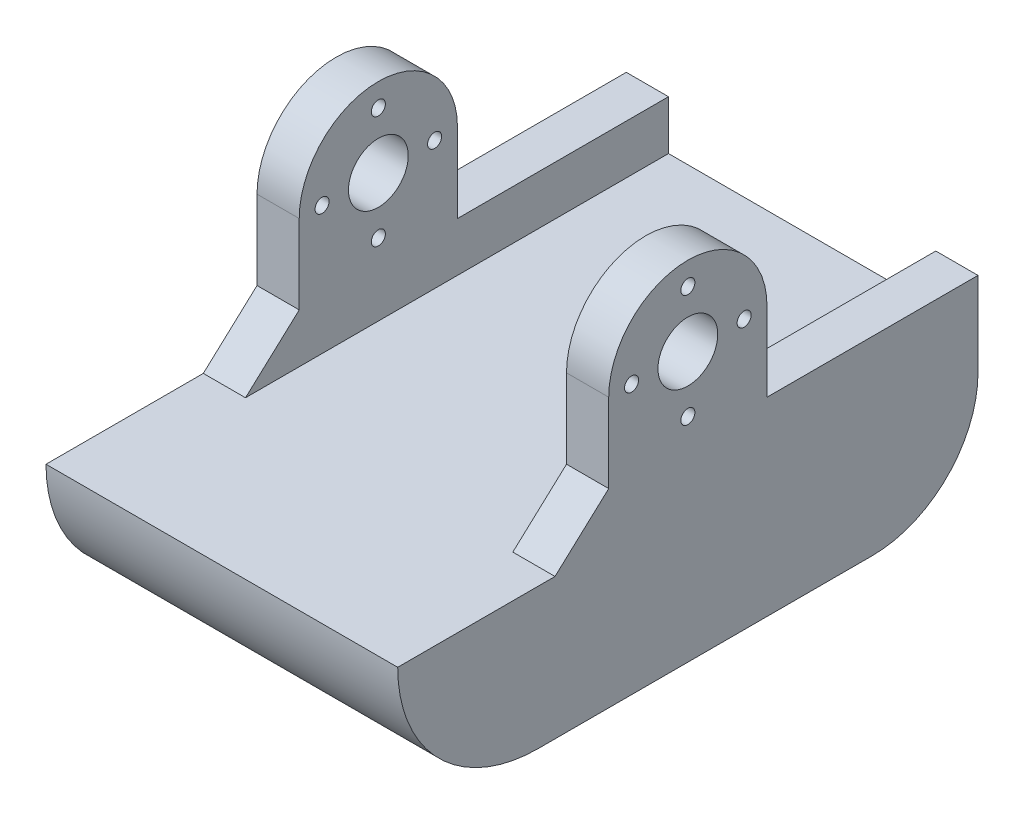
from build123d import *

# Parameters (mm, degrees)
SKETCH1_W            = 50
SKETCH1_H            = 170
BOSS_EXTRUDE1_DEPTH  = 55
SKETCH2_W            = 34
SKETCH2_H            = 27
CUT_EXTRUDE1_DEPTH   = 181.416185527
SKETCH3_W            = 10
SKETCH3_H            = 24
SKETCH3_R            = 4.25
SKETCH3_R_2          = 1
CUT_EXTRUDE2_DEPTH   = 186.539753153
SKETCH4_W            = 2
SKETCH4_H            = 24
CUT_EXTRUDE3_DEPTH   = 178.623196683
SKETCH5_W            = 6.25
SKETCH5_H            = 11.25
CUT_EXTRUDE4_DEPTH   = 186.539753153
SKETCH6_W            = 38
SKETCH6_H            = 10
CUT_EXTRUDE5_DEPTH   = 181.416185527
SKETCH8_W            = 13.25
SKETCH8_H            = 2.25
CUT_EXTRUDE7_DEPTH   = 186.539753153
SKETCH9_W            = 34
SKETCH9_H            = 35.25
CUT_EXTRUDE8_DEPTH   = 179.297679458
SKETCH11_W           = 13.25
SKETCH11_H           = 20.25
CUT_EXTRUDE9_DEPTH   = 184.480414486
SKETCH12_W           = 28.5
SKETCH12_H           = 15
BOSS_EXTRUDE2_DEPTH  = 8
SKETCH14_W           = 34
SKETCH14_H           = 15
SKETCH14_H_2         = 10.25
BOSS_EXTRUDE3_DEPTH  = 13.25
SKETCH16_R           = 4.5
SKETCH16_R_2         = 2.5
CUT_EXTRUDE13_DEPTH  = 8
SKETCH17_R           = 4.5
SKETCH17_W           = 55
SKETCH17_H           = 10.25
CUT_EXTRUDE15_DEPTH  = 175.384811552
SKETCH18_W           = 71.25
SKETCH18_H           = 27.5
SKETCH18_W_2         = 13.75
SKETCH18_W_3         = 16.25
BOSS_EXTRUDE4_DEPTH  = 50
SKETCH19_W           = 38
SKETCH19_H           = 7
CUT_EXTRUDE16_DEPTH  = 152.25227271
SKETCH20_W           = 57.5
SKETCH20_H           = 27.5
CUT_EXTRUDE17_DEPTH  = 102.137591923
CUT_EXTRUDE18_DEPTH  = 100.39221549
SKETCH22_W           = 82.5
SKETCH22_H           = 2.5
BOSS_EXTRUDE5_DEPTH  = 50
SKETCH24_W           = 22
SKETCH24_H           = 17
CUT_EXTRUDE19_DEPTH  = 101.710289941
SKETCH25_W           = 38
SKETCH25_H           = 38.136363636
CUT_EXTRUDE20_DEPTH  = 10
SKETCH26_W           = 82.5
SKETCH26_H           = 2.5
CUT_EXTRUDE21_DEPTH  = 101.710289941
SKETCH27_W           = 38
SKETCH27_H           = 5
BOSS_EXTRUDE6_DEPTH  = 60.14
SKETCH29_W           = 38
SKETCH29_H           = 5
BOSS_EXTRUDE8_DEPTH  = 60.14
SKETCH30_W           = 6
SKETCH30_H           = 17
BOSS_EXTRUDE9_DEPTH  = 22.14
SKETCH31_W           = 22.363636364
SKETCH31_H           = 20.5
BOSS_EXTRUDE10_DEPTH = 50
SKETCH32_W           = 82.5
SKETCH32_H           = 0.5
SKETCH32_W_2         = 0.14
SKETCH32_H_2         = 17
CUT_EXTRUDE22_DEPTH  = 100.489105434
FILLET1_R            = 15
FILLET2_R            = 20


with BuildPart() as part:
    # Sketch1 → Boss-Extrude1 (new body)
    with BuildSketch(Plane.XY):
        with Locations((0, -85)):
            Rectangle(SKETCH1_W, SKETCH1_H)
    extrude(amount=-BOSS_EXTRUDE1_DEPTH)

    # Sketch2 → Cut-Extrude1 (cut, through all)
    with BuildSketch(Plane.XY):
        with Locations((0, -13.5)):
            Rectangle(SKETCH2_W, SKETCH2_H)
    extrude(amount=-CUT_EXTRUDE1_DEPTH, mode=Mode.SUBTRACT)

    # Sketch3 → Cut-Extrude2 (cut, through all)
    with BuildSketch(Plane(origin=(25, 0, 0), x_dir=(0, 0, -1), z_dir=(1, 0, 0))):
        with Locations((50, -12)):
            Rectangle(SKETCH3_W, SKETCH3_H)
        with Locations((5, -12)):
            Rectangle(SKETCH3_W, SKETCH3_H)
        with Locations(Location((27.5, -12.75, 0), (0, 0, 90))):
            Circle(SKETCH3_R)
        with Locations(Location((35.5, -12.75, 0), (0, 0, 90))):
            Circle(SKETCH3_R_2)
        with Locations(Location((27.5, -4.75, 0), (0, 0, 90))):
            Circle(SKETCH3_R_2)
        with Locations(Location((27.5, -20.75, 0), (0, 0, 90))):
            Circle(SKETCH3_R_2)
        with Locations(Location((19.5, -12.75, 0), (0, 0, 90))):
            Circle(SKETCH3_R_2)
    extrude(amount=-CUT_EXTRUDE2_DEPTH, mode=Mode.SUBTRACT)

    # Sketch4 → Cut-Extrude3 (cut, through all)
    with BuildSketch(Plane.XY.offset(-10)):
        with Locations((-18, -12)):
            Rectangle(SKETCH4_W, SKETCH4_H)
        with Locations((18, -12)):
            Rectangle(SKETCH4_W, SKETCH4_H)
    extrude(amount=-CUT_EXTRUDE3_DEPTH, mode=Mode.SUBTRACT)

    # Sketch5 → Cut-Extrude4 (cut, through all)
    with BuildSketch(Plane(origin=(25, 0, 0), x_dir=(0, 0, -1), z_dir=(1, 0, 0))):
        with BuildLine():
            Line((45, 0), (10, 0))
            Line((10, 0), (10, -12.75))
            Line((10, -12.75), (16.25, -12.75))
            ThreePointArc((16.25, -12.75), (27.5, -1.5), (38.75, -12.75))
            Line((38.75, -12.75), (45, -12.75))
            Line((45, -12.75), (45, 0))
        make_face()
        with Locations((13.125, -18.375)):
            Rectangle(SKETCH5_W, SKETCH5_H)
        with Locations((41.875, -18.375)):
            Rectangle(SKETCH5_W, SKETCH5_H)
    extrude(amount=-CUT_EXTRUDE4_DEPTH, mode=Mode.SUBTRACT)

    # Sketch6 → Cut-Extrude5 (cut, through all)
    with BuildSketch(Plane.XY):
        with Locations((0, -29)):
            Rectangle(SKETCH6_W, SKETCH6_H)
    extrude(amount=-CUT_EXTRUDE5_DEPTH, mode=Mode.SUBTRACT)

    # Sketch8 → Cut-Extrude7 (cut, through all)
    with BuildSketch(Plane(origin=(25, 0, 0), x_dir=(0, 0, -1), z_dir=(1, 0, 0))):
        with BuildLine():
            Line((27.5, -157.5), (27.5, -132.5))
            Line((27.5, -132.5), (13.25, -132.5))
            Line((13.25, -132.5), (13.25, -167.75))
            Line((13.25, -167.75), (17.25, -167.75))
            ThreePointArc((17.25, -167.75), (20.252155493, -160.502155493), (27.5, -157.5))
        make_face()
        with BuildLine():
            Line((41.75, -167.75), (41.75, -132.5))
            Line((41.75, -132.5), (27.5, -132.5))
            Line((27.5, -132.5), (27.5, -157.5))
            ThreePointArc((27.5, -157.5), (34.747844507, -160.502155493), (37.75, -167.75))
            Line((37.75, -167.75), (41.75, -167.75))
        make_face()
        with Locations((48.375, -168.875)):
            Rectangle(SKETCH8_W, SKETCH8_H)
        with Locations((6.625, -168.875)):
            Rectangle(SKETCH8_W, SKETCH8_H)
        with BuildLine():
            Line((17.25, -167.75), (13.25, -167.75))
            Line((13.25, -167.75), (13.25, -170))
            Line((13.25, -170), (17.5, -170))
            ThreePointArc((17.5, -170), (17.31269172, -168.881923142), (17.25, -167.75))
        make_face()
        with BuildLine():
            Line((41.75, -170), (41.75, -167.75))
            Line((41.75, -167.75), (37.75, -167.75))
            ThreePointArc((37.75, -167.75), (37.68730828, -168.881923142), (37.5, -170))
            Line((37.5, -170), (41.75, -170))
        make_face()
        with BuildLine():
            Line((27.5, -167.75), (27.5, -157.5))
            ThreePointArc((27.5, -157.5), (20.252155493, -160.502155493), (17.25, -167.75))
            Line((17.25, -167.75), (27.5, -167.75))
        make_face()
        with BuildLine():
            ThreePointArc((37.75, -167.75), (34.747844507, -160.502155493), (27.5, -157.5))
            Line((27.5, -157.5), (27.5, -167.75))
            Line((27.5, -167.75), (37.75, -167.75))
        make_face()
        with BuildLine():
            Line((27.5, -170), (27.5, -167.75))
            Line((27.5, -167.75), (17.25, -167.75))
            ThreePointArc((17.25, -167.75), (17.31269172, -168.881923142), (17.5, -170))
            Line((17.5, -170), (27.5, -170))
        make_face()
        with BuildLine():
            ThreePointArc((37.5, -170), (37.68730828, -168.881923142), (37.75, -167.75))
            Line((37.75, -167.75), (27.5, -167.75))
            Line((27.5, -167.75), (27.5, -170))
            Line((27.5, -170), (37.5, -170))
        make_face()
    extrude(amount=-CUT_EXTRUDE7_DEPTH, mode=Mode.SUBTRACT)

    # Sketch9 → Cut-Extrude8 (cut, through all)
    with BuildSketch(Plane.XY):
        with Locations((0, -150.125)):
            Rectangle(SKETCH9_W, SKETCH9_H)
    extrude(amount=-CUT_EXTRUDE8_DEPTH, mode=Mode.SUBTRACT)

    # Sketch11 → Cut-Extrude9 (cut, through all)
    with BuildSketch(Plane(origin=(25, 0, 0), x_dir=(0, 0, -1), z_dir=(1, 0, 0))):
        with BuildLine():
            ThreePointArc((17.25, -167.75), (20.252155493, -160.502155493), (27.5, -157.5))
            Line((27.5, -157.5), (27.5, -147.5))
            Line((27.5, -147.5), (13.25, -147.5))
            Line((13.25, -147.5), (13.25, -167.75))
            Line((13.25, -167.75), (17.25, -167.75))
        make_face()
        with BuildLine():
            Line((27.5, -147.5), (27.5, -157.5))
            ThreePointArc((27.5, -157.5), (34.747844507, -160.502155493), (37.75, -167.75))
            Line((37.75, -167.75), (41.75, -167.75))
            Line((41.75, -167.75), (41.75, -147.5))
            Line((41.75, -147.5), (27.5, -147.5))
        make_face()
        with Locations((48.375, -157.625)):
            Rectangle(SKETCH11_W, SKETCH11_H)
        with Locations((6.625, -157.625)):
            Rectangle(SKETCH11_W, SKETCH11_H)
    extrude(amount=-CUT_EXTRUDE9_DEPTH, mode=Mode.SUBTRACT)

    # Sketch12 → Boss-Extrude2 (add)
    with BuildSketch(Plane(origin=(25, 0, 0), x_dir=(0, 0, -1), z_dir=(1, 0, 0))):
        with Locations((27.5, -140)):
            Rectangle(SKETCH12_W, SKETCH12_H)
    boss_extrude2 = extrude(amount=-BOSS_EXTRUDE2_DEPTH)

    # Mirror1: Boss-Extrude2 across plane
    add(boss_extrude2.mirror(Plane(origin=(0, 0, 0), x_dir=(0, 0, 1), z_dir=(1, 0, 0))))

    # Sketch14 → Boss-Extrude3 (add)
    with BuildSketch(Plane.XY):
        with Locations((0, -140)):
            Rectangle(SKETCH14_W, SKETCH14_H)
        with Locations((0, -152.625)):
            Rectangle(SKETCH14_W, SKETCH14_H_2)
    boss_extrude3 = extrude(amount=-BOSS_EXTRUDE3_DEPTH)

    # Mirror2: Boss-Extrude3 across plane
    add(boss_extrude3.mirror(Plane.XY.offset(-27.5)))

    # Sketch16 → Cut-Extrude13 (cut)
    # profile 1 of 3: a face of its own
    with BuildSketch(Plane(origin=(25, 0, 0), x_dir=(0, 0, -1), z_dir=(1, 0, 0))):
        with Locations(Location((16.5, -135.75, 0), (0, 0, 90))):
            Circle(SKETCH16_R)
        with Locations((16.5, -135.75)):
            Circle(SKETCH16_R_2, mode=Mode.SUBTRACT)
    # profile 2 of 3: a face of its own
    with BuildSketch(Plane(origin=(25, 0, 0), x_dir=(0, 0, -1), z_dir=(1, 0, 0))):
        with Locations((16.5, -135.75)):
            Circle(SKETCH16_R_2)
    # profile 3 of 3: a face of its own
    with BuildSketch(Plane(origin=(25, 0, 0), x_dir=(0, 0, -1), z_dir=(1, 0, 0))):
        with Locations(Location((38.5, -135.75, 0), (0, 0, 90))):
            Circle(SKETCH16_R)
    cut_extrude13 = extrude(amount=-CUT_EXTRUDE13_DEPTH, mode=Mode.SUBTRACT)

    # Mirror3: Cut-Extrude13 across plane
    add(cut_extrude13.mirror(Plane(origin=(0, 0, 0), x_dir=(0, 0, 1), z_dir=(1, 0, 0))), mode=Mode.SUBTRACT)

    # Sketch17 → Cut-Extrude15 (cut, through all)
    # profile 1 of 4: a face of its own
    with BuildSketch(Plane(origin=(25, 0, 0), x_dir=(0, 0, -1), z_dir=(1, 0, 0))):
        Polygon((55, -51.5), (27.5, -51.5), (0, -51.5), (0, -147.5), (55, -147.5), align=None)
        with Locations((16.5, -135.75)):
            Circle(SKETCH17_R, mode=Mode.SUBTRACT)
        with Locations((38.5, -135.75)):
            Circle(SKETCH17_R, mode=Mode.SUBTRACT)
    # profile 2 of 4: a face of its own
    with BuildSketch(Plane(origin=(25, 0, 0), x_dir=(0, 0, -1), z_dir=(1, 0, 0))):
        with Locations((27.5, -152.625)):
            Rectangle(SKETCH17_W, SKETCH17_H)
    # profile 3 of 4: a face of its own
    with BuildSketch(Plane(origin=(25, 0, 0), x_dir=(0, 0, -1), z_dir=(1, 0, 0))):
        with Locations((38.5, -135.75)):
            Circle(SKETCH17_R)
    # profile 4 of 4: a face of its own
    with BuildSketch(Plane(origin=(25, 0, 0), x_dir=(0, 0, -1), z_dir=(1, 0, 0))):
        with Locations((16.5, -135.75)):
            Circle(SKETCH17_R)
    extrude(amount=-CUT_EXTRUDE15_DEPTH, mode=Mode.SUBTRACT)

    # Sketch18 → Boss-Extrude4 (add)
    with BuildSketch(Plane(origin=(25, 0, 0), x_dir=(0, 0, -1), z_dir=(1, 0, 0))):
        with Locations((-35.625, -37.75)):
            Rectangle(SKETCH18_W, SKETCH18_H)
        with Locations((61.875, -37.75)):
            Rectangle(SKETCH18_W_2, SKETCH18_H)
        Polygon((38.75, -51.5), (38.75, -24), (16.25, -24), (0, -24), (0, -51.5), align=None)
        with Locations((46.875, -37.75)):
            Rectangle(SKETCH18_W_3, SKETCH18_H)
    extrude(amount=-BOSS_EXTRUDE4_DEPTH)

    # Sketch19 → Cut-Extrude16 (cut, through all)
    with BuildSketch(Plane.XY.offset(71.25)):
        with Locations((0, -27.5)):
            Rectangle(SKETCH19_W, SKETCH19_H)
    extrude(amount=-CUT_EXTRUDE16_DEPTH, mode=Mode.SUBTRACT)

    # Sketch20 → Cut-Extrude17 (cut, through all)
    with BuildSketch(Plane(origin=(25, 0, 0), x_dir=(0, 0, -1), z_dir=(1, 0, 0))):
        with Locations((-42.5, -37.75)):
            Rectangle(SKETCH20_W, SKETCH20_H)
    extrude(amount=-CUT_EXTRUDE17_DEPTH, mode=Mode.SUBTRACT)

    # Sketch21 → Cut-Extrude18 (cut, through all)
    with BuildSketch(Plane(origin=(25, 0, 0), x_dir=(0, 0, -1), z_dir=(1, 0, 0))):
        Polygon((16.25, -24), (-13.75, -51.5), (-13.75, -24), align=None)
    extrude(amount=-CUT_EXTRUDE18_DEPTH, mode=Mode.SUBTRACT)

    # Sketch22 → Boss-Extrude5 (add)
    with BuildSketch(Plane(origin=(25, 0, 0), x_dir=(0, 0, -1), z_dir=(1, 0, 0))):
        with Locations((27.5, -52.75)):
            Rectangle(SKETCH22_W, SKETCH22_H)
    extrude(amount=-BOSS_EXTRUDE5_DEPTH)

    # Sketch24 → Cut-Extrude19 (cut, through all)
    with BuildSketch(Plane(origin=(25, 0, 0), x_dir=(0, 0, -1), z_dir=(1, 0, 0))):
        with Locations((57.75, -32.5)):
            Rectangle(SKETCH24_W, SKETCH24_H)
    extrude(amount=-CUT_EXTRUDE19_DEPTH, mode=Mode.SUBTRACT)

    # Sketch25 → Cut-Extrude20 (cut)
    with BuildSketch(Plane(origin=(0, -31, 0), x_dir=(1, 0, 0), z_dir=(0, 1, 0))):
        with Locations((0, 27.681818182)):
            Rectangle(SKETCH25_W, SKETCH25_H)
    extrude(amount=-CUT_EXTRUDE20_DEPTH, mode=Mode.SUBTRACT)

    # Sketch26 → Cut-Extrude21 (cut, through all)
    with BuildSketch(Plane(origin=(25, 0, 0), x_dir=(0, 0, -1), z_dir=(1, 0, 0))):
        with Locations((27.5, -52.75)):
            Rectangle(SKETCH26_W, SKETCH26_H)
    extrude(amount=-CUT_EXTRUDE21_DEPTH, mode=Mode.SUBTRACT)

    # Sketch27 → Boss-Extrude6 (add)
    with BuildSketch(Plane(origin=(0, 0, -8.613636364), x_dir=(-1, 0, 0), z_dir=(0, 0, -1))):
        with Locations((0, -38.5)):
            Rectangle(SKETCH27_W, SKETCH27_H)
    extrude(amount=BOSS_EXTRUDE6_DEPTH)

    # Sketch29 → Boss-Extrude8 (add)
    with BuildSketch(Plane(origin=(0, 0, -8.613636364), x_dir=(-1, 0, 0), z_dir=(0, 0, -1))):
        with Locations((0, -33.5)):
            Rectangle(SKETCH29_W, SKETCH29_H)
    extrude(amount=BOSS_EXTRUDE8_DEPTH)

    # Sketch30 → Boss-Extrude9 (add)
    with BuildSketch(Plane(origin=(0, 0, -46.75), x_dir=(-1, 0, 0), z_dir=(0, 0, -1))):
        with Locations((-22, -32.5)):
            Rectangle(SKETCH30_W, SKETCH30_H)
        with Locations((22, -32.5)):
            Rectangle(SKETCH30_W, SKETCH30_H)
    extrude(amount=BOSS_EXTRUDE9_DEPTH)

    # Sketch31 → Boss-Extrude10 (add)
    with BuildSketch(Plane(origin=(25, 0, 0), x_dir=(0, 0, -1), z_dir=(1, 0, 0))):
        with Locations((-2.568181818, -41.25)):
            Rectangle(SKETCH31_W, SKETCH31_H)
    extrude(amount=-BOSS_EXTRUDE10_DEPTH)

    # Sketch32 → Cut-Extrude22 (cut, through all)
    with BuildSketch(Plane(origin=(25, 0, 0), x_dir=(0, 0, -1), z_dir=(1, 0, 0))):
        with Locations((27.5, -51.25)):
            Rectangle(SKETCH32_W, SKETCH32_H)
        with Locations((68.82, -32.5)):
            Rectangle(SKETCH32_W_2, SKETCH32_H_2)
    extrude(amount=-CUT_EXTRUDE22_DEPTH, mode=Mode.SUBTRACT)

    # Fillet1
    fillet1_edges = [part.edges().sort_by_distance(p)[0] for p in [
        (0, -51, -68.75),
    ]]
    fillet(fillet1_edges, radius=FILLET1_R)

    # Fillet2
    fillet2_edges = [part.edges().sort_by_distance(p)[0] for p in [
        (0, -51, 13.75),
    ]]
    fillet(fillet2_edges, radius=FILLET2_R - 0.0001)  # a hair under: the kernel refuses the full size


solid = part.part
